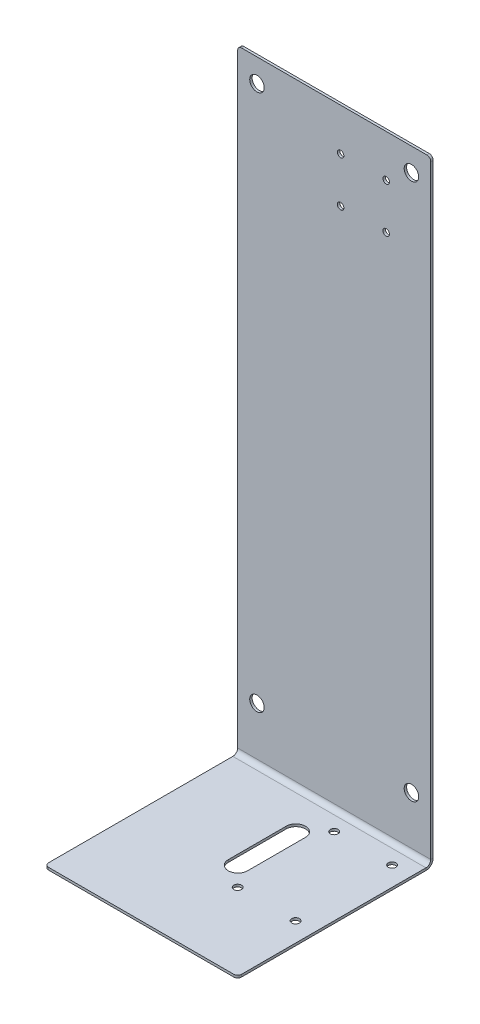
from build123d import *

# Parameters (mm, degrees)
SKETCH2_W            = 127
SKETCH2_H            = 406.4
BOSS_EXTRUDE1_DEPTH  = 3.175
SKETCH3_W            = 127
SKETCH3_H            = 3.175
BOSS_EXTRUDE2_DEPTH  = 127
FILLET1_R            = 3.175
SKETCH4_R            = 2.54
CUT_EXTRUDE1_DEPTH   = 429.448574802
SKETCH5_R            = 4.7625
SKETCH5_R_2          = 2.15
CUT_EXTRUDE2_DEPTH   = 248.894110458
CONVERT_SOLID1_START = -63.5
CONVERT_SOLID1_DEPTH = 127
FILLET2_R            = 2.54


# Read off the part's stored shape, not the designer's step: Convert-Solid1
with BuildPart() as part:
    # Sketch2 → Boss-Extrude1 (new body)
    with BuildSketch(Plane.XY):
        Rectangle(SKETCH2_W, SKETCH2_H)
    extrude(amount=BOSS_EXTRUDE1_DEPTH)

    # Sketch3 → Boss-Extrude2 (add)
    with BuildSketch(Plane.XY.offset(3.175)):
        with Locations((0, -201.6125)):
            Rectangle(SKETCH3_W, SKETCH3_H)
    extrude(amount=BOSS_EXTRUDE2_DEPTH)

    # Fillet1
    fillet1_edges = [part.edges().sort_by_distance(p)[0] for p in [
        (0, -200.025, 3.175),
        (0, -203.2, 0),
    ]]
    fillet(fillet1_edges, radius=FILLET1_R)

    # Sketch4 → Cut-Extrude1 (cut, through all)
    with BuildSketch(Plane(origin=(0, -200.025, 0), x_dir=(1, 0, 0), z_dir=(0, 1, 0))):
        with BuildLine():
            ThreePointArc((-6.167107762, -66.675), (0.182892238, -73.025), (6.532892238, -66.675))
            Line((6.532892238, -66.675), (6.532892238, -28.575))
            ThreePointArc((6.532892238, -28.575), (0.182892238, -22.225), (-6.167107762, -28.575))
            Line((-6.167107762, -28.575), (-6.167107762, -66.675))
        make_face()
        with Locations(Location((12.7, -79.375, 0), (0, 0, 270))):
            Circle(SKETCH4_R)
        with Locations(Location((50.8, -79.375, 0), (0, 0, 270))):
            Circle(SKETCH4_R)
        with Locations(Location((50.8, -15.875, 0), (0, 0, 270))):
            Circle(SKETCH4_R)
        with Locations(Location((12.7, -15.875, 0), (0, 0, 270))):
            Circle(SKETCH4_R)
    extrude(amount=-CUT_EXTRUDE1_DEPTH, mode=Mode.SUBTRACT)

    # Sketch5 → Cut-Extrude2 (cut, through all)
    with BuildSketch(Plane.XY.offset(3.175)):
        with Locations((-50.8, 187.96)):
            Circle(SKETCH5_R)
        with Locations((50.8, 187.96)):
            Circle(SKETCH5_R)
        with Locations((-50.8, -165.1)):
            Circle(SKETCH5_R)
        with Locations((50.8, -165.1)):
            Circle(SKETCH5_R)
        with Locations((34.20875, 175.39)):
            Circle(SKETCH5_R_2)
        with Locations((4.20875, 175.39)):
            Circle(SKETCH5_R_2)
        with Locations((4.20875, 145.69)):
            Circle(SKETCH5_R_2)
        with Locations((34.20875, 145.69)):
            Circle(SKETCH5_R_2)
    extrude(amount=-CUT_EXTRUDE2_DEPTH, mode=Mode.SUBTRACT)

    # Convert-Solid1 outline → Convert-Solid1 (cut)
    with BuildSketch(Plane.YZ.offset(CONVERT_SOLID1_START)):
        with BuildLine():
            ThreePointArc((-196.85, 1.5875), (-200.217596045, 2.982403955), (-201.6125, 6.35))
            Line((-201.6125, 6.35), (-201.6125, 130.175))
            Line((-201.6125, 130.175), (-203.2, 130.175))
            Line((-203.2, 130.175), (-203.2, 3.175))
            ThreePointArc((-203.2, 3.175), (-202.27006403, 0.92993597), (-200.025, 0))
            Line((-200.025, 0), (203.2, 0))
            Line((203.2, 0), (203.2, 1.5875))
            Line((203.2, 1.5875), (-196.85, 1.5875))
        make_face()
    extrude(amount=CONVERT_SOLID1_DEPTH, mode=Mode.SUBTRACT)

    # Fillet2
    fillet2_edges = [part.edges().sort_by_distance(p)[0] for p in [
        (63.5, -200.81875, 130.175),
        (-63.5, -200.81875, 130.175),
        (-63.5, 203.2, 2.38125),
        (63.5, 203.2, 2.38125),
    ]]
    fillet(fillet2_edges, radius=FILLET2_R)


solid = part.part
